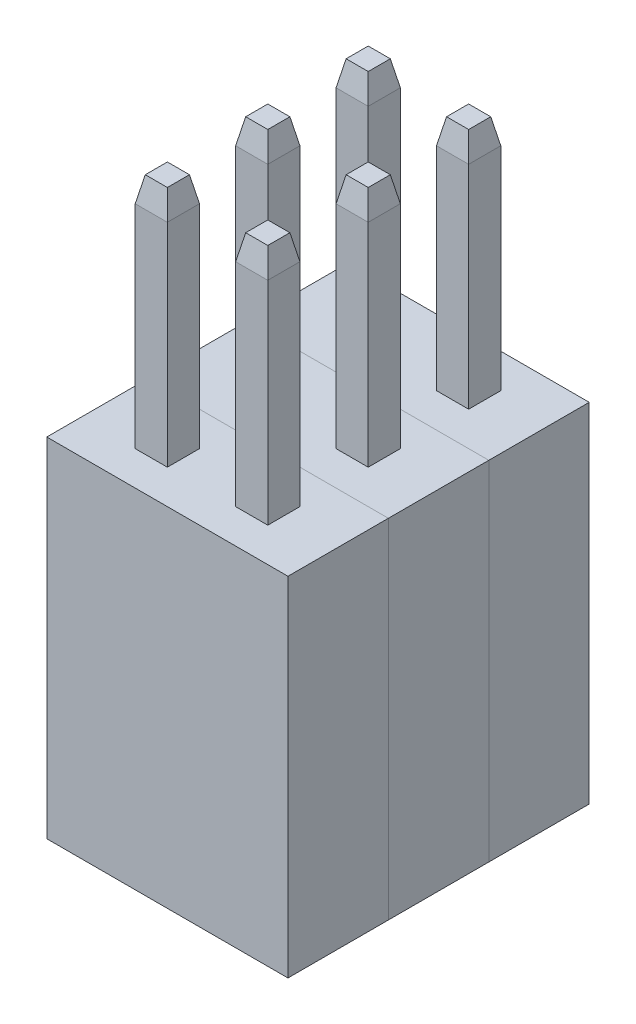
from build123d import *
from OCP.BRepFilletAPI import BRepFilletAPI_MakeChamfer

# Parameters (mm, degrees)
SKETCH1_W           = 3.05
SKETCH1_H           = 1.27
BOSS_EXTRUDE2_DEPTH = 4.4
SWEEP5_START        = 4.4
SWEEP5_OUTLINE_W    = 0.4064
SWEEP5_OUTLINE_H    = 0.4064
SWEEP5_DEPTH        = 3
SKETCH6_W           = 0.4064
SKETCH6_H           = 0.4064
CHAMFER1_SIZE       = 0.0635
CHAMFER1_SIZE2      = 0.3175
CHAMFER2_SIZE       = 0.3175
CHAMFER2_SIZE2      = 0.0635
LPATTERN1_COUNT     = 3
LPATTERN1_PITCH     = 1.27


# Read off the part's stored shape, not the designer's step: Sweep5
with BuildPart() as part:
    # Sketch1 → Boss-Extrude2 (new body)
    with BuildSketch(Plane(origin=(0, 0, 0), x_dir=(1, 0, 0), z_dir=(0, 1, 0))):
        Rectangle(SKETCH1_W, SKETCH1_H)
    extrude(amount=BOSS_EXTRUDE2_DEPTH)

    # Sweep5 outline → Sweep5 (add)
    with BuildSketch(Plane(origin=(0, 0, 0), x_dir=(1, 0, 0), z_dir=(0, 1, 0)).offset(SWEEP5_START)):
        with Locations((-0.635, 0)):
            Rectangle(SWEEP5_OUTLINE_W, SWEEP5_OUTLINE_H)
    extrude(amount=SWEEP5_DEPTH)

    # Sweep6: sweep along a path in Sketch7
    with BuildLine(Plane.XY) as sweep6_path:
        Line((0.635, 4.4), (0.635, 7.4))
    # Sketch6 → Sweep6 (sweep)
    with BuildSketch(Plane(origin=(0, 7.4, 0), x_dir=(1, 0, 0), z_dir=(0, 1, 0))):
        with Locations((0.635, 0)):
            Rectangle(SKETCH6_W, SKETCH6_H)
    sweep(path=sweep6_path.line)

    # Chamfer1
    chamfer1_edges = [part.edges().sort_by_distance(p)[0] for p in [
        (-0.635, 7.4, -0.2032),
        (-0.4318, 7.4, 0),
        (-0.635, 7.4, 0.2032),
        (-0.8382, 7.4, 0),
    ]]
    chamfer1_side = [part.faces().sort_by_distance(p)[0] for p in [
        (-0.635, 7.4, 0),
    ]]
    chamfer(chamfer1_edges, length=CHAMFER1_SIZE, length2=CHAMFER1_SIZE2, reference=chamfer1_side[0])

    # Chamfer2: one chamfer whose edges measure the first distance from different faces: ONE call of the kernel's chamfer builder (chamfer() names one face for all edges)
    chamfer2_edges_1 = [part.edges().sort_by_distance(p)[0] for p in [
        (0.8382, 7.4, 0),
    ]]
    chamfer2_side_1 = [part.faces().sort_by_distance(p)[0] for p in [
        (0.8382, 5.9, 0),
    ]]
    chamfer2_edges_2 = [part.edges().sort_by_distance(p)[0] for p in [
        (0.635, 7.4, -0.2032),
    ]]
    chamfer2_side_2 = [part.faces().sort_by_distance(p)[0] for p in [
        (0.635, 5.9, -0.2032),
    ]]
    chamfer2_edges_3 = [part.edges().sort_by_distance(p)[0] for p in [
        (0.4318, 7.4, 0),
    ]]
    chamfer2_side_3 = [part.faces().sort_by_distance(p)[0] for p in [
        (0.4318, 5.9, 0),
    ]]
    chamfer2_edges_4 = [part.edges().sort_by_distance(p)[0] for p in [
        (0.635, 7.4, 0.2032),
    ]]
    chamfer2_side_4 = [part.faces().sort_by_distance(p)[0] for p in [
        (0.635, 5.9, 0.2032),
    ]]
    chamfer2 = BRepFilletAPI_MakeChamfer(part.part.solid().wrapped)
    for e in chamfer2_edges_1:
        chamfer2.Add(CHAMFER2_SIZE, CHAMFER2_SIZE2, e.wrapped, chamfer2_side_1[0].wrapped)  # the first distance lies on this face
    for e in chamfer2_edges_2:
        chamfer2.Add(CHAMFER2_SIZE, CHAMFER2_SIZE2, e.wrapped, chamfer2_side_2[0].wrapped)  # the first distance lies on this face
    for e in chamfer2_edges_3:
        chamfer2.Add(CHAMFER2_SIZE, CHAMFER2_SIZE2, e.wrapped, chamfer2_side_3[0].wrapped)  # the first distance lies on this face
    for e in chamfer2_edges_4:
        chamfer2.Add(CHAMFER2_SIZE, CHAMFER2_SIZE2, e.wrapped, chamfer2_side_4[0].wrapped)  # the first distance lies on this face
    add(Compound.cast(chamfer2.Shape()), mode=Mode.REPLACE)


with BuildPart() as lpattern1_1:
    # LPattern1: pattern copy
    add(part.part.moved(Location(Vector(0, 0, -1) * (1 * LPATTERN1_PITCH))))


with BuildPart() as lpattern1_2:
    # LPattern1: pattern copy
    add(part.part.moved(Location(Vector(0, 0, -1) * (2 * LPATTERN1_PITCH))))


solid = Compound([part.part, lpattern1_1.part, lpattern1_2.part])
